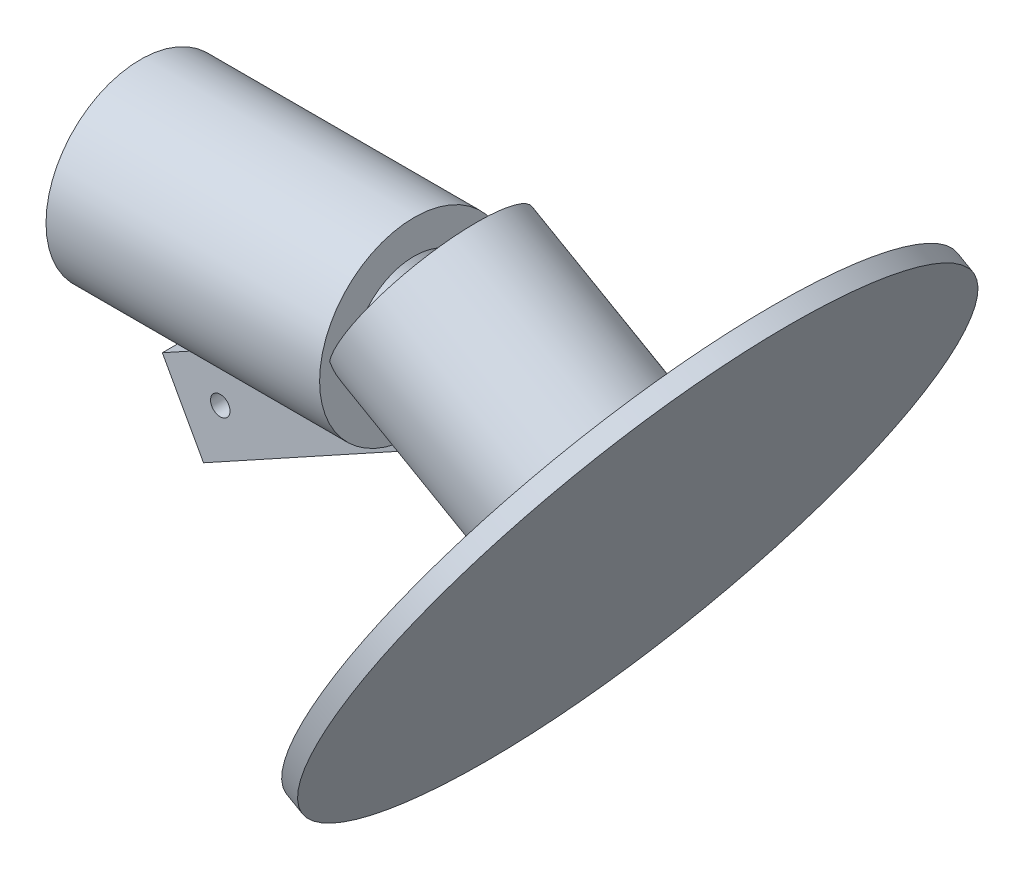
from build123d import *

# Parameters (mm, degrees)
TAB_DEPTH               = 3
CABLE_PIN_HOLE_SKETCH_R = 1.6
CABLE_PIN_HOLE_DEPTH    = 6
BORE_CLEAR_SKETCH_W     = 26
BORE_CLEAR_SKETCH_H     = 13.45


with BuildPart() as part:
    # Pad And Pedestal Sketch → Pad And Pedestal (revolve)
    with BuildSketch(Plane.XY):
        Polygon((1481.589408105, -12.415318093), (1506.420044292, 30.983293711), (1503.816127584, 32.473131883), (1486.434682253, 2.094103619), (1455.187681754, 19.972161674), (1453.697843582, 17.368244965), (1482.340927374, 0.980025082), (1476.381574689, -9.435641751), align=None)
    revolve(axis=Axis((1511.968436369, -29.796763424, 0), (-0.8679722360942783, 0.4966127237289622, 0)))

    # Socket Sketch → Socket (revolve)
    with BuildSketch(Plane.XY):
        Polygon((1400, 13.45), (1400, 15.5), (1444.890102203, 15.5), (1444.890102203, 10), (1430, 10), (1430, 0), (1425, 0), (1425, 13.45), align=None)
    revolve(axis=Axis((-3000, 0, 0), (1, 0, 0)))

    # Tab Sketch → Tab (add, symmetric)
    with BuildSketch(Plane.XY):
        Polygon((1465.019568481, -5.166098693), (1413.342666954, -33.635342599), (1406.587253146, -21.373026982), (1458.264154673, 7.096216924), align=None)
    extrude(amount=TAB_DEPTH, both=True)

    # Cable Pin Hole Sketch → Cable Pin Hole (cut, symmetric)
    with BuildSketch(Plane.XY):
        with Locations((1416.096117858, -24.126477887)):
            Circle(CABLE_PIN_HOLE_SKETCH_R)
    extrude(amount=CABLE_PIN_HOLE_DEPTH, both=True, mode=Mode.SUBTRACT)

    # Bore Clear Sketch → Bore Clear (revolve, cut)
    with BuildSketch(Plane.XY):
        with Locations((1412, 6.725)):
            Rectangle(BORE_CLEAR_SKETCH_W, BORE_CLEAR_SKETCH_H)
    revolve(axis=Axis((-3000, 0, 0), (1, 0, 0)), mode=Mode.SUBTRACT)


solid = part.part
